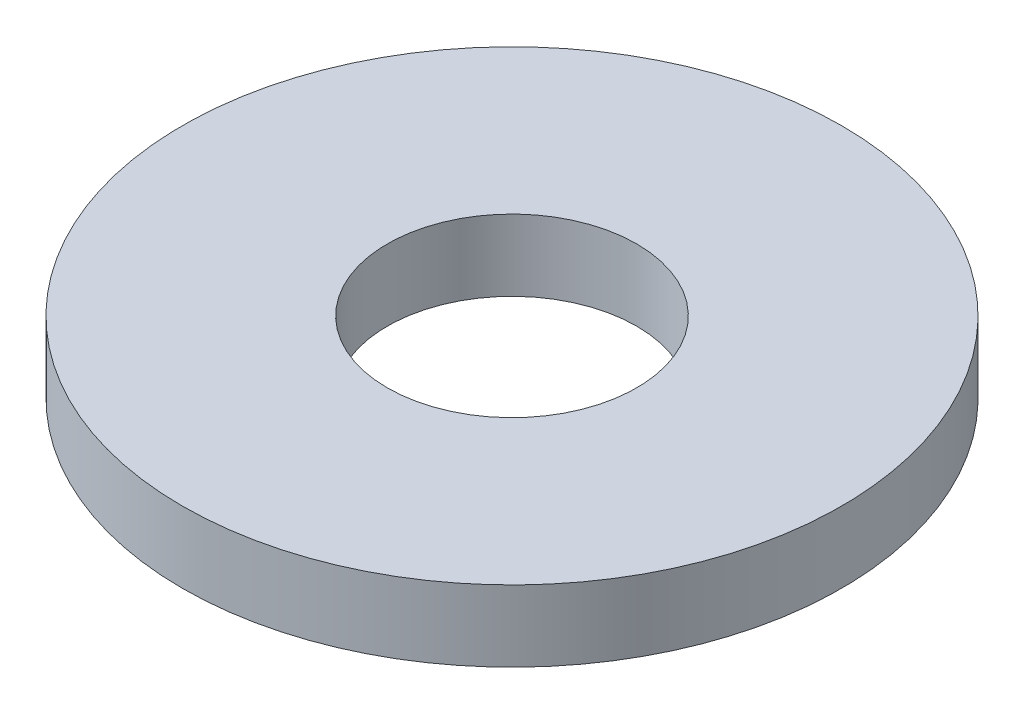
from build123d import *

# Parameters (mm, degrees)
SKETCH1_R           = 92.5
BOSS_EXTRUDE1_DEPTH = 20
SKETCH2_R           = 35
CUT_EXTRUDE1_DEPTH  = 133.334802679


with BuildPart() as part:
    # Sketch1 → Boss-Extrude1 (new body)
    with BuildSketch(Plane(origin=(0, 0, 0), x_dir=(1, 0, 0), z_dir=(0, 1, 0))):
        Circle(SKETCH1_R)
    extrude(amount=BOSS_EXTRUDE1_DEPTH)

    # Sketch2 → Cut-Extrude1 (cut, through all)
    with BuildSketch(Plane(origin=(0, 0, 0), x_dir=(1, 0, 0), z_dir=(0, 1, 0))):
        Circle(SKETCH2_R)
    extrude(amount=CUT_EXTRUDE1_DEPTH, mode=Mode.SUBTRACT)


solid = part.part
